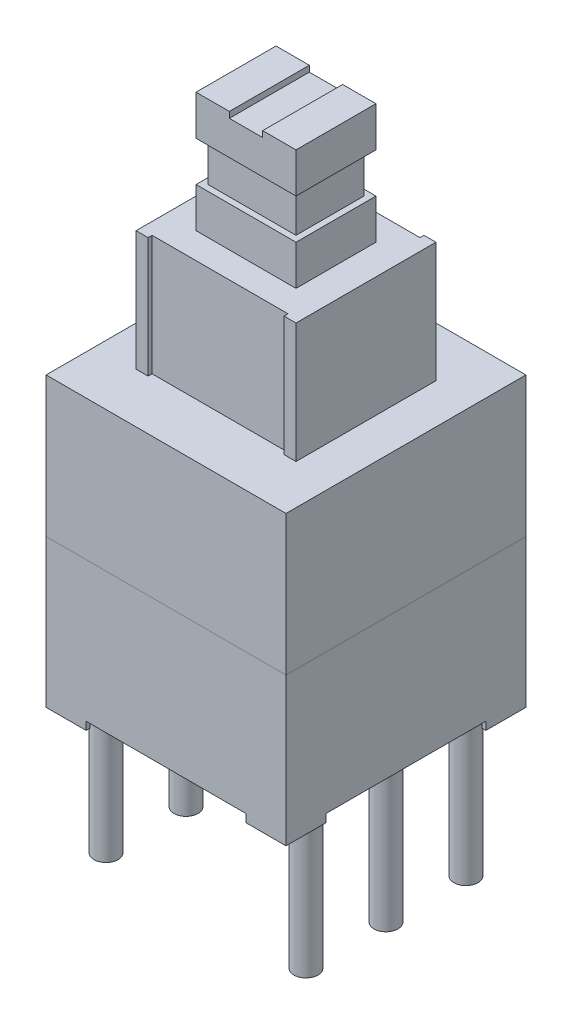
from build123d import *

# Parameters (mm, degrees)
SKETCH_1_W                     = 6
SKETCH_1_H                     = 6
EXTRUDE_1_DEPTH                = 7
SPLIT_BODIES_1_SURFACE_1_BACK  = 12
SPLIT_BODIES_1_SURFACE_1_DEPTH = 24
SPLIT_BODIES_1_SURFACE_2_BACK  = 12
SPLIT_BODIES_1_SURFACE_2_DEPTH = 24
SKETCH_3_W                     = 4
SKETCH_3_H                     = 3.5
EXTRUDE_2_DEPTH                = 3
EXTRUDE_START                  = 3
SKETCH_3_3_W                   = 2.5
SKETCH_3_3_H                   = 2
EXTRUDE_3_DEPTH                = 3
SKETCH_4_W                     = 0.833333334
SKETCH_4_H                     = 0.3
CUT_EXTRUDE_1_DEPTH            = 14.928388277
SWEEP_START                    = 11
SWEEP_1_OUTLINE_W              = 2.5
SWEEP_1_OUTLINE_H              = 2
SWEEP_1_OUTLINE_W_2            = 2.2
SWEEP_1_OUTLINE_H_2            = 1.7
SWEEP_1_DEPTH                  = 1
SKETCH_10_W                    = 3.4
SKETCH_10_H                    = 0.2
CUT_EXTRUDE_2_DEPTH            = 3
EXTRUDE_4_DEPTH                = 0.2
SKETCH_12_R                    = 0.3
EXTRUDE_5_DEPTH                = 3.6
EXTRUDE_5_2_DEPTH              = 3.6
EXTRUDE_5_3_DEPTH              = 3.6
EXTRUDE_5_4_DEPTH              = 3.6
EXTRUDE_5_5_DEPTH              = 3.6
EXTRUDE_5_6_DEPTH              = 3.6


# Read off the part's stored shape, not the designer's step: Вырез-По траектории1
with BuildPart() as part:
    # Эскиз1 → Бобышка-Вытянуть1 (new body)
    with BuildSketch(Plane(origin=(0, 0, 0), x_dir=(1, 0, 0), z_dir=(0, 1, 0))):
        Rectangle(SKETCH_1_W, SKETCH_1_H)
    extrude(amount=EXTRUDE_1_DEPTH)


with BuildPart() as body_2:
    # Split Bodies 1: the piece behind the surface
    add(part.part)
    # Split Bodies 1 surface: a surface, the sketch's curves swept straight by 24 mm
    with BuildLine(Plane.XY.offset(3).offset(-SPLIT_BODIES_1_SURFACE_1_BACK), mode=Mode.PRIVATE) as split_bodies_1_surface_1_path:
        Line((-3, 3.5), (3, 3.5))
    split_bodies_1_surface_1 = Shell.extrude(split_bodies_1_surface_1_path.wire(), (0 * SPLIT_BODIES_1_SURFACE_1_DEPTH, 0 * SPLIT_BODIES_1_SURFACE_1_DEPTH, 1 * SPLIT_BODIES_1_SURFACE_1_DEPTH))
    split(bisect_by=split_bodies_1_surface_1, keep=Keep.BOTTOM)

    # Эскиз11 → Бобышка-Вытянуть4 (add)
    with BuildSketch(Plane.XZ):
        Polygon((-3, 3), (-2, 3), (-2, 2.9), (-2.9, 2.9), (-2.9, 2), (-3, 2), align=None)
        Polygon((2, 3), (2, 2.9), (2.9, 2.9), (2.9, 2), (3, 2), (3, 3), align=None)
        Polygon((3, -2), (2.9, -2), (2.9, -2.9), (2, -2.9), (2, -3), (3, -3), align=None)
        Polygon((-3, -2), (-2.9, -2), (-2.9, -2.9), (-2, -2.9), (-2, -3), (-3, -3), align=None)
    extrude(amount=EXTRUDE_4_DEPTH)


with BuildPart() as part_1:
    add(part.part)

    # Split Bodies 1: split by a surface, the side it looks to stays
    # Split Bodies 1 surface: a surface, the sketch's curves swept straight by 24 mm
    with BuildLine(Plane.XY.offset(3).offset(-SPLIT_BODIES_1_SURFACE_2_BACK), mode=Mode.PRIVATE) as split_bodies_1_surface_2_path:
        Line((-3, 3.5), (3, 3.5))
    split_bodies_1_surface_2 = Shell.extrude(split_bodies_1_surface_2_path.wire(), (0 * SPLIT_BODIES_1_SURFACE_2_DEPTH, 0 * SPLIT_BODIES_1_SURFACE_2_DEPTH, 1 * SPLIT_BODIES_1_SURFACE_2_DEPTH))
    split(bisect_by=split_bodies_1_surface_2, keep=Keep.TOP)


with BuildPart() as body_3:
    # Эскиз3 → Бобышка-Вытянуть2 (new body)
    with BuildSketch(Plane(origin=(0, 7, 0), x_dir=(1, 0, 0), z_dir=(0, 1, 0))):
        Rectangle(SKETCH_3_W, SKETCH_3_H)
    extrude(amount=EXTRUDE_2_DEPTH)

    # Эскиз3<3> → Бобышка-Вытянуть3 (add)
    with BuildSketch(Plane(origin=(0, 7, 0), x_dir=(1, 0, 0), z_dir=(0, 1, 0)).offset(EXTRUDE_START)):
        Rectangle(SKETCH_3_3_W, SKETCH_3_3_H)
    extrude(amount=EXTRUDE_3_DEPTH)

    # Эскиз4 → Вырез-Вытянуть1 (cut, through all)
    with BuildSketch(Plane.XY.offset(1)):
        with Locations((0, 13)):
            Rectangle(SKETCH_4_W, SKETCH_4_H)
    extrude(amount=-CUT_EXTRUDE_1_DEPTH, mode=Mode.SUBTRACT)

    # Вырез-По траектории1 outline → Вырез-По траектории1 (cut)
    with BuildSketch(Plane(origin=(0, 0, 0), x_dir=(1, 0, 0), z_dir=(0, 1, 0)).offset(SWEEP_START)):
        Rectangle(SWEEP_1_OUTLINE_W, SWEEP_1_OUTLINE_H)
        Rectangle(SWEEP_1_OUTLINE_W_2, SWEEP_1_OUTLINE_H_2, mode=Mode.SUBTRACT)
    extrude(amount=SWEEP_1_DEPTH, mode=Mode.SUBTRACT)

    # Эскиз10 → Вырез-Вытянуть2 (cut)
    with BuildSketch(Plane(origin=(0, 10, 0), x_dir=(1, 0, 0), z_dir=(0, 1, 0))):
        with Locations((0, -1.75)):
            Rectangle(SKETCH_10_W, SKETCH_10_H)
        with Locations((0, 1.75)):
            Rectangle(SKETCH_10_W, SKETCH_10_H)
    extrude(amount=-CUT_EXTRUDE_2_DEPTH, mode=Mode.SUBTRACT)


with BuildPart() as body_4:
    # Эскиз12 → Бобышка-Вытянуть5 (new body)
    with BuildSketch(Plane.XZ):
        with Locations(Location((-2.5, 2, 0), (0, 0, 270))):
            Circle(SKETCH_12_R)
    extrude(amount=EXTRUDE_5_DEPTH)


with BuildPart() as body_5:
    # Эскиз12 → Extrude 5 2 (new body)
    with BuildSketch(Plane.XZ):
        with Locations(Location((2.5, 2, 0), (0, 0, 270))):
            Circle(SKETCH_12_R)
    extrude(amount=EXTRUDE_5_2_DEPTH)


with BuildPart() as body_6:
    # Эскиз12 → Extrude 5 3 (new body)
    with BuildSketch(Plane.XZ):
        with Locations(Location((2.5, 0, 0), (0, 0, 270))):
            Circle(SKETCH_12_R)
    extrude(amount=EXTRUDE_5_3_DEPTH)


with BuildPart() as body_7:
    # Эскиз12 → Extrude 5 4 (new body)
    with BuildSketch(Plane.XZ):
        with Locations(Location((2.5, -2, 0), (0, 0, 270))):
            Circle(SKETCH_12_R)
    extrude(amount=EXTRUDE_5_4_DEPTH)


with BuildPart() as body_8:
    # Эскиз12 → Extrude 5 5 (new body)
    with BuildSketch(Plane.XZ):
        with Locations(Location((-2.5, 0, 0), (0, 0, 270))):
            Circle(SKETCH_12_R)
    extrude(amount=EXTRUDE_5_5_DEPTH)


with BuildPart() as body_9:
    # Эскиз12 → Extrude 5 6 (new body)
    with BuildSketch(Plane.XZ):
        with Locations(Location((-2.5, -2, 0), (0, 0, 270))):
            Circle(SKETCH_12_R)
    extrude(amount=EXTRUDE_5_6_DEPTH)


solid = Compound([body_2.part, part_1.part, body_3.part, body_4.part, body_5.part, body_6.part, body_7.part, body_8.part, body_9.part])
